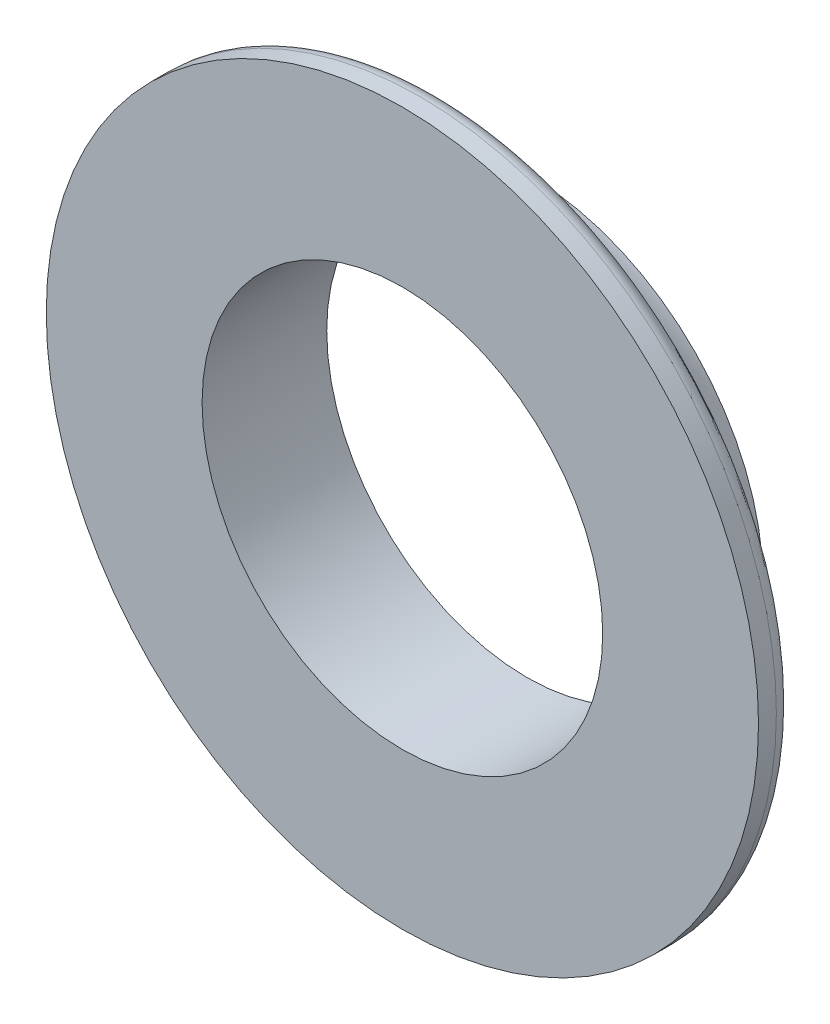
from build123d import *

# Parameters (mm, degrees)
SKETCH1_R           = 13.25
SKETCH1_R_2         = 11.25
BOSS_EXTRUDE1_DEPTH = 7
SKETCH2_R           = 20
BOSS_EXTRUDE2_DEPTH = 2
FILLET1_R           = 6
SKETCH3_R           = 11.25
CUT_EXTRUDE1_DEPTH  = 2
FILLET2_R           = 1


with BuildPart() as part:
    # Sketch1 → Boss-Extrude1 (new body)
    with BuildSketch(Plane.XY):
        Circle(SKETCH1_R)
        Circle(SKETCH1_R_2, mode=Mode.SUBTRACT)
    extrude(amount=BOSS_EXTRUDE1_DEPTH)

    # Sketch2 → Boss-Extrude2 (add)
    with BuildSketch(Plane.XY.offset(7)):
        Circle(SKETCH2_R)
    extrude(amount=-BOSS_EXTRUDE2_DEPTH)

    # Fillet1
    # the kernel refuses this fillet: 6 mm, written as the material it adds along each edge
    with BuildSketch(Plane(origin=(0, 0, 5), x_dir=(1, 0, 0), z_dir=(0, 1, 0))) as fillet1_piece_1:
        with BuildLine():
            CenterArc((19.166079783, 6), FILLET1_R, 189.594068227, 80.405931773)
            Line((19.166079783, 0), (19.166079783, -0.12))
            Line((19.166079783, -0.12), (13.25, -0.12))
            Line((13.25, -0.12), (13.13, 0))
            ThreePointArc((13.13, 0), (13.13, 2.5), (13.131678404, 4.98))
            Line((13.131678404, 4.98), (13.25, 5))
        make_face()
    revolve(axis=Axis((0, 0, 5), (0, 0, -1)))

    # Sketch3 → Cut-Extrude1 (cut)
    with BuildSketch(Plane(origin=(0, 0, 5), x_dir=(-1, 0, 0), z_dir=(0, 0, -1))):
        Circle(SKETCH3_R)
    extrude(amount=-CUT_EXTRUDE1_DEPTH, mode=Mode.SUBTRACT)

    # Fillet2
    fillet2_edges = [part.edges().sort_by_distance(p)[0] for p in [
        (-20, 0, 5),
    ]]
    fillet(fillet2_edges, radius=FILLET2_R)


solid = part.part
